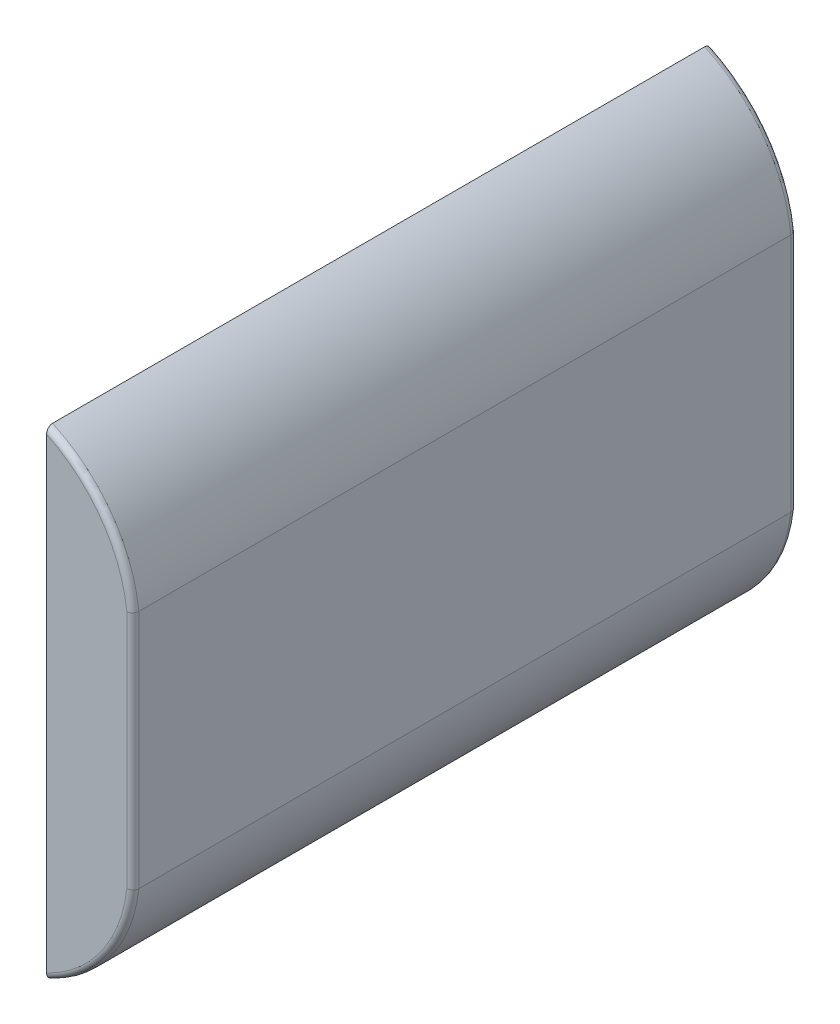
from build123d import *

# Parameters (mm, degrees)
MAIN_SHAPE_DEPTH = 110.6
HOLLOW_T         = -1.8
FILLETS_R        = 1


with BuildPart() as part:
    # Sketch for the main shape → Main shape (new body)
    with BuildSketch(Plane.XY):
        with BuildLine():
            Line((14.361069392, 19.95), (14.361069392, 59.95))
            ThreePointArc((14.361069392, 59.95), (9.818254591, 71.823770849), (0, 79.9))
            Line((0, 79.9), (0, 0))
            ThreePointArc((0, 0), (9.818254591, 8.076229151), (14.361069392, 19.95))
        make_face()
    extrude(amount=MAIN_SHAPE_DEPTH)

    # Hollow
    hollow_openings = [part.faces().sort_by_distance(p)[0] for p in [
        (0, 39.95, 55.3),
    ]]
    offset(amount=HOLLOW_T, openings=hollow_openings, kind=Kind.INTERSECTION)

    # Fillets
    # the kernel refuses this fillet: 1 mm, written as the material it takes off along each edge
    with BuildSketch(Plane(origin=(-10.361710586, 57.297160312, 110.6), x_dir=(0.9999799478441757, 0.006332764764284822, 0), z_dir=(0.006332764764284822, -0.9999799478441757, 0))) as fillets_piece_1:
        with BuildLine():
            CenterArc((24.864702054 - FILLETS_R, -FILLETS_R), FILLETS_R, 0, 90)
            Line((24.864702054 - FILLETS_R, 0), (24.864702054, 0))
            Line((24.864702054, 0), (24.864702054, -FILLETS_R))
        make_face()
    revolve(axis=Axis((-10.361710586, 57.297160312, 110.6), (0, 0, 1)), revolution_arc=70.771001335, mode=Mode.SUBTRACT)
    with BuildSketch(Plane(origin=(-10.361710586, 22.602839688, 110.6), x_dir=(0.32335851179223435, -0.9462765308573977, 0), z_dir=(-0.9462765308573977, -0.32335851179223435, 0))) as fillets_piece_2:
        with BuildLine():
            CenterArc((24.864702054 - FILLETS_R, -FILLETS_R), FILLETS_R, 0, 90)
            Line((24.864702054 - FILLETS_R, 0), (24.864702054, 0))
            Line((24.864702054, 0), (24.864702054, -FILLETS_R))
        make_face()
    revolve(axis=Axis((-10.361710586, 22.602839688, 110.6), (0, 0, 1)), revolution_arc=70.771001335, mode=Mode.SUBTRACT)
    with BuildSketch(Plane(origin=(-10.361710586, 57.297160312, 0), x_dir=(0.9999799478441757, 0.006332764764284822, 0), z_dir=(0.006332764764284822, -0.9999799478441757, 0))) as fillets_piece_3:
        with BuildLine():
            CenterArc((24.864702054 - FILLETS_R, FILLETS_R), FILLETS_R, 270, 90)
            Line((24.864702054 - FILLETS_R, 0), (24.864702054, 0))
            Line((24.864702054, 0), (24.864702054, FILLETS_R))
        make_face()
    revolve(axis=Axis((-10.361710586, 57.297160312, 0), (0, 0, 1)), revolution_arc=70.771001335, mode=Mode.SUBTRACT)
    with BuildSketch(Plane(origin=(14.361069392, 17.45, 0), x_dir=(0, 0, 1), z_dir=(0, 1, 0))) as fillets_piece_4:
        with BuildLine():
            CenterArc((FILLETS_R, -FILLETS_R), FILLETS_R, 90, 90)
            Line((0, -FILLETS_R), (0, 0))
            Line((0, 0), (FILLETS_R, 0))
        make_face()
    extrude(amount=45, mode=Mode.SUBTRACT)
    with BuildSketch(Plane(origin=(-10.361710586, 22.602839688, 0), x_dir=(0.32335851179223435, -0.9462765308573977, 0), z_dir=(-0.9462765308573977, -0.32335851179223435, 0))) as fillets_piece_5:
        with BuildLine():
            CenterArc((24.864702054 - FILLETS_R, FILLETS_R), FILLETS_R, 270, 90)
            Line((24.864702054 - FILLETS_R, 0), (24.864702054, 0))
            Line((24.864702054, 0), (24.864702054, FILLETS_R))
        make_face()
    revolve(axis=Axis((-10.361710586, 22.602839688, 0), (0, 0, 1)), revolution_arc=70.771001335, mode=Mode.SUBTRACT)
    with BuildSketch(Plane(origin=(14.361069392, 17.45, 110.6), x_dir=(0, 0, -1), z_dir=(0, 1, 0))) as fillets_piece_6:
        with BuildLine():
            CenterArc((FILLETS_R, FILLETS_R), FILLETS_R, 180, 90)
            Line((0, FILLETS_R), (0, 0))
            Line((0, 0), (FILLETS_R, 0))
        make_face()
    extrude(amount=45, mode=Mode.SUBTRACT)


solid = part.part
